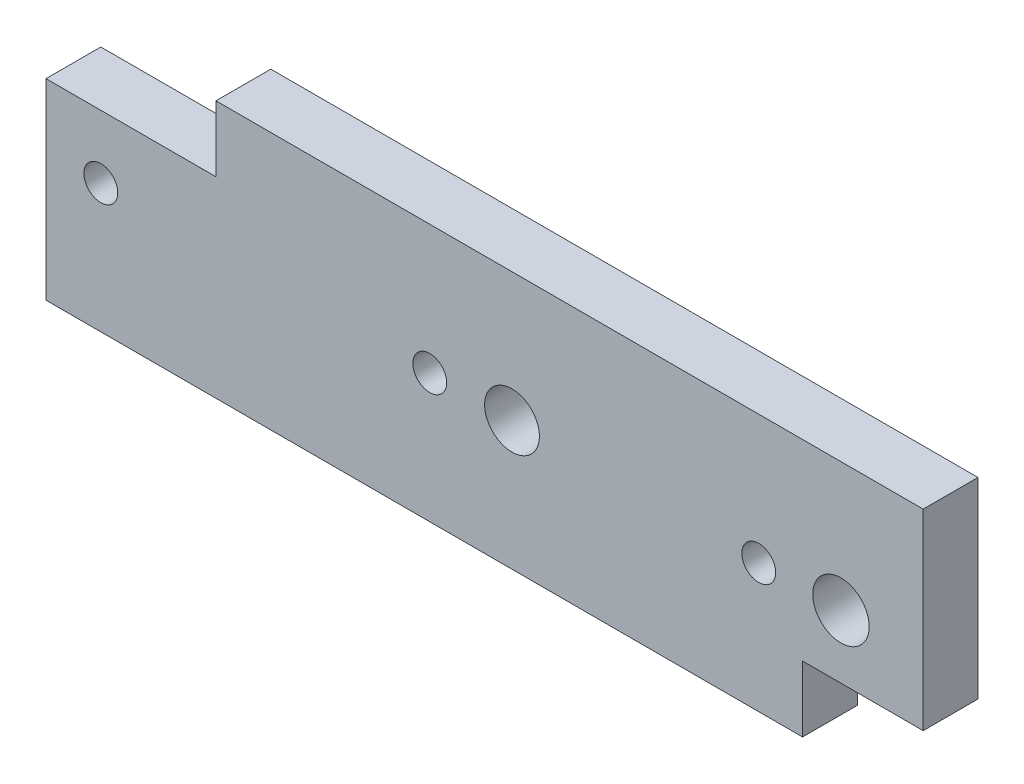
from build123d import *

# Parameters (mm, degrees)
SKETCH1_W           = 160
SKETCH1_H           = 47
BOSS_EXTRUDE1_DEPTH = 10
SKETCH3_W           = 22
SKETCH3_H           = 12
SKETCH3_W_2         = 31
CUT_EXTRUDE1_DEPTH  = 10
SKETCH4_R           = 5
SKETCH4_R_2         = 5.146446609
SKETCH4_R_3         = 3.087867966
CUT_EXTRUDE2_DEPTH  = 10


with BuildPart() as part:
    # Sketch1 → Boss-Extrude1 (new body)
    with BuildSketch(Plane.XY):
        with Locations((-50, 0)):
            Rectangle(SKETCH1_W, SKETCH1_H)
    extrude(amount=BOSS_EXTRUDE1_DEPTH)

    # Sketch3 → Cut-Extrude1 (cut)
    with BuildSketch(Plane(origin=(0, 0, 0), x_dir=(-1, 0, 0), z_dir=(0, 0, -1))):
        with Locations((-19, -17.5)):
            Rectangle(SKETCH3_W, SKETCH3_H)
        with Locations((114.5, 17.5)):
            Rectangle(SKETCH3_W_2, SKETCH3_H)
    extrude(amount=-CUT_EXTRUDE1_DEPTH, mode=Mode.SUBTRACT)

    # Sketch4 → Cut-Extrude2 (cut)
    with BuildSketch(Plane.XY.offset(10)):
        with Locations((-45, 0)):
            Circle(SKETCH4_R)
        with Locations((15, 0)):
            Circle(SKETCH4_R_2)
        Circle(SKETCH4_R_3)
        with Locations((-60, 0)):
            Circle(SKETCH4_R_3)
        with Locations((-120, 0)):
            Circle(SKETCH4_R_3)
    extrude(amount=-CUT_EXTRUDE2_DEPTH, mode=Mode.SUBTRACT)


solid = part.part
